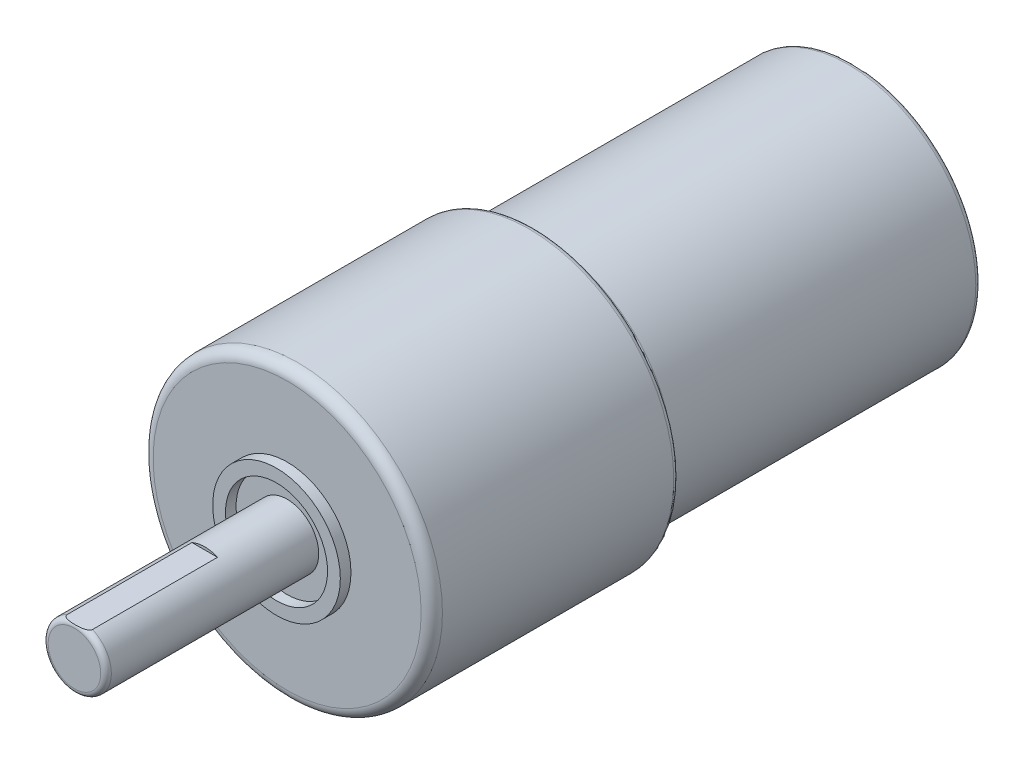
from build123d import *

# Parameters (mm, degrees)
SKETCH1_R               = 13.6
BOSS_EXTRUDE1_DEPTH     = 23.25
SKETCH2_R               = 12
BOSS_EXTRUDE2_DEPTH     = 30
FILLET1_R               = 1
FILLET2_R               = 1
SKETCH3_R               = 6
SKETCH3_R_2             = 4.8
BOSS_EXTRUDE3_DEPTH     = 1
SKETCH4_R               = 2.97
BOSS_EXTRUDE4_DEPTH     = 20
CUT_EXTRUDE1_DEPTH      = 76.7329684
CUT_EXTRUDE1_DEPTH_BACK = 12.25
FILLET3_R               = 0.5
FILLET4_R               = 0.5
FILLET5_R               = 0.5


with BuildPart() as part:
    # Sketch1 → Boss-Extrude1 (new body)
    with BuildSketch(Plane.XY):
        Circle(SKETCH1_R)
    extrude(amount=-BOSS_EXTRUDE1_DEPTH)

    # Fillet2
    fillet2_edges = [part.edges().sort_by_distance(p)[0] for p in [
        (-13.6, 0, 0),
    ]]
    fillet(fillet2_edges, radius=FILLET2_R)

    # Sketch3 → Boss-Extrude3 (add)
    with BuildSketch(Plane.XY):
        Circle(SKETCH3_R)
        Circle(SKETCH3_R_2, mode=Mode.SUBTRACT)
    extrude(amount=BOSS_EXTRUDE3_DEPTH)

    # Sketch4 → Boss-Extrude4 (add)
    with BuildSketch(Plane.XY):
        Circle(SKETCH4_R)
    extrude(amount=BOSS_EXTRUDE4_DEPTH)

    # Sketch5 → Cut-Extrude1 (cut, two sides: drawn at the far end of the back side and taken through both)
    with BuildSketch(Plane.XY.offset(20).offset(-CUT_EXTRUDE1_DEPTH_BACK)):
        Polygon((-55.264817477, 2.715), (-1.204024501, 2.715), (1.204024501, 2.715), (55.264817477, 2.715), (55.264817477, 110.83658595), (-55.264817477, 110.83658595), align=None)
    extrude(amount=CUT_EXTRUDE1_DEPTH + CUT_EXTRUDE1_DEPTH_BACK, mode=Mode.SUBTRACT)

    # Fillet3
    # the kernel refuses this fillet: 0.5 mm, written as the material it takes off along each edge
    with BuildSketch(Plane(origin=(0, 0, 20), x_dir=(0.004730320040790282, 0.9999888119735698, 0), z_dir=(0.9999888119735698, -0.004730320040790282, 0))) as fillet3_piece_1:
        with BuildLine():
            CenterArc((2.97 - FILLET3_R, -FILLET3_R), FILLET3_R, 0, 90)
            Line((2.97 - FILLET3_R, 0), (2.97, 0))
            Line((2.97, 0), (2.97, -FILLET3_R))
        make_face()
    revolve(axis=Axis((0, 0, 20), (0, 0, 1)), revolution_arc=270.271028385, mode=Mode.SUBTRACT)
    with BuildSketch(Plane(origin=(0, 0, 20), x_dir=(1, 0, 0), z_dir=(0, -1, 0))) as fillet3_piece_2:
        with BuildLine():
            CenterArc((2.97 - FILLET3_R, -FILLET3_R), FILLET3_R, 0, 90)
            Line((2.97 - FILLET3_R, 0), (2.97, 0))
            Line((2.97, 0), (2.97, -FILLET3_R))
        make_face()
    revolve(axis=Axis((0, 0, 20), (0, 0, 1)), revolution_arc=90.203696588, mode=Mode.SUBTRACT)

    # Fillet4
    fillet4_edges = [part.edges().sort_by_distance(p)[0] for p in [
        (-13.6, 0, -23.25),
    ]]
    fillet(fillet4_edges, radius=FILLET4_R)


with BuildPart() as body_2:
    # Sketch2 → Boss-Extrude2 (new body)
    with BuildSketch(Plane(origin=(0, 0, -23.25), x_dir=(-1, 0, 0), z_dir=(0, 0, -1))):
        Circle(SKETCH2_R)
    extrude(amount=BOSS_EXTRUDE2_DEPTH)

    # Fillet1
    fillet1_edges = [body_2.edges().sort_by_distance(p)[0] for p in [
        (12, 0, -23.25),
    ]]
    fillet(fillet1_edges, radius=FILLET1_R)

    # Fillet5
    fillet5_edges = [body_2.edges().sort_by_distance(p)[0] for p in [
        (12, 0, -53.25),
    ]]
    fillet(fillet5_edges, radius=FILLET5_R)


solid = Compound([part.part, body_2.part])
